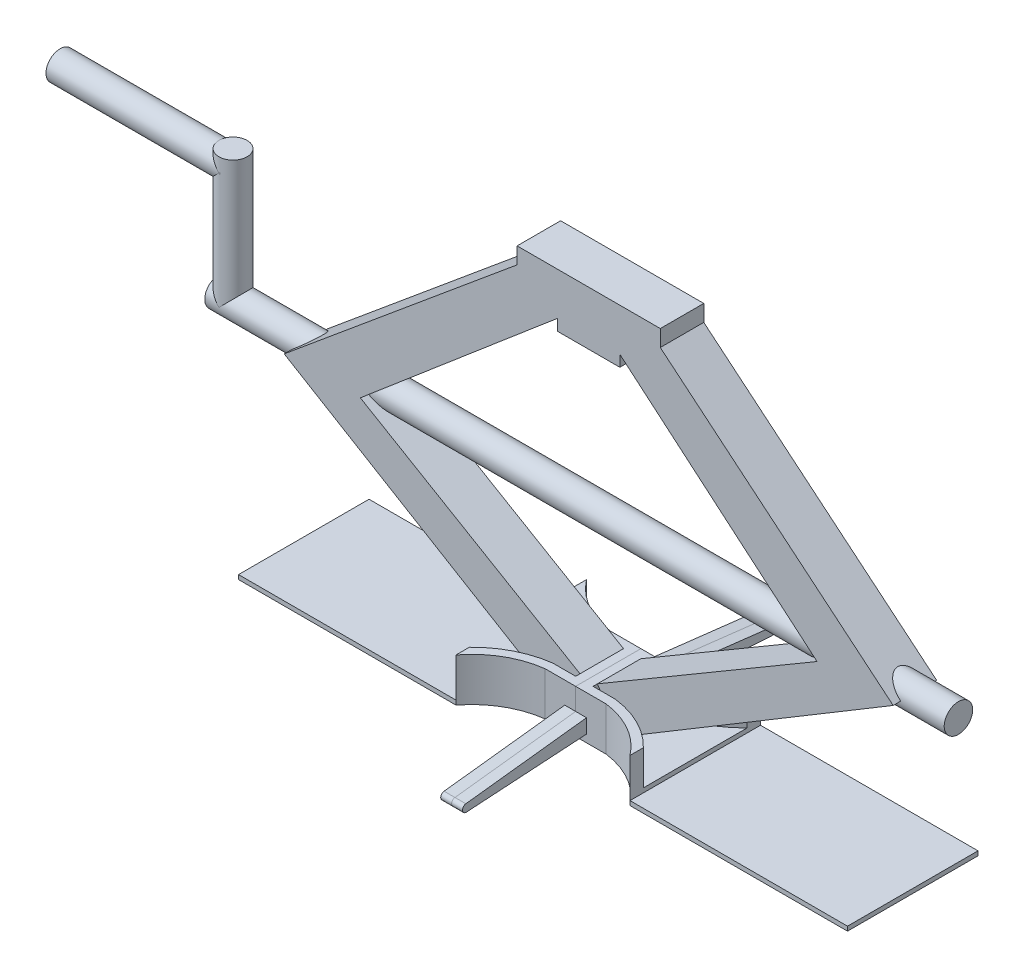
from build123d import *

# Parameters (mm, degrees)
SKETCH2_W                 = 127
SKETCH2_H                 = 76.2
BOSS_EXTRUDE1_DEPTH       = 2.54
BOSS_EXTRUDE2_DEPTH       = 25.4
SHELL1_START              = 5.08
SHELL1_DEPTH              = 20.32
BOSS_EXTRUDE10_DEPTH      = 25.4
BOSS_EXTRUDE11_DEPTH      = 6.35
BOSS_EXTRUDE12_DEPTH      = 203.2
BOSS_EXTRUDE12_DEPTH_BACK = 228.6
SKETCH9_R                 = 8.30646
SKETCH10_R                = 8.255
BOSS_EXTRUDE13_DEPTH      = 76.2
SKETCH11_R                = 8.255
BOSS_EXTRUDE14_DEPTH      = 101.6


# Read off the part's stored shape, not the designer's step: Shell1
with BuildPart() as part:
    # Sketch2 → Boss-Extrude1 (new body)
    with BuildSketch(Plane(origin=(0, 0, 0), x_dir=(1, 0, 0), z_dir=(0, 1, 0))):
        with Locations((-114.3, 0)):
            Rectangle(SKETCH2_W, SKETCH2_H)
    extrude(amount=BOSS_EXTRUDE1_DEPTH)

    # Sketch6 → Boss-Extrude2 (add)
    with BuildSketch(Plane(origin=(0, 0, 0), x_dir=(1, 0, 0), z_dir=(0, 1, 0))):
        with BuildLine():
            Line((-17.860834, -19.05), (0, -19.05))
            Line((0, -19.05), (0, 19.05))
            Line((0, 19.05), (-17.860834, 19.05))
            ThreePointArc((-17.860834, 19.05), (-36.23522, 25.281425), (-50.8, 38.1))
            Line((-50.8, 38.1), (-50.8, -38.1))
            ThreePointArc((-50.8, -38.1), (-36.23522, -25.281425), (-17.860834, -19.05))
        make_face()
    extrude(amount=BOSS_EXTRUDE2_DEPTH)

    # Shell1 outline → Shell1 (cut)
    with BuildSketch(Plane(origin=(0, 0, 0), x_dir=(1, 0, 0), z_dir=(0, 1, 0)).offset(SHELL1_START)):
        with BuildLine():
            Line((-50.8, 30.306695), (-50.8, -30.306695))
            ThreePointArc((-50.8, -30.306695), (-35.897253, -19.331005), (-18.182365, -13.97))
            Line((-18.182365, -13.97), (-5.08, -13.97))
            Line((-5.08, -13.97), (-5.08, 13.97))
            Line((-5.08, 13.97), (-18.182365, 13.97))
            ThreePointArc((-18.182365, 13.97), (-35.897253, 19.331005), (-50.8, 30.306695))
        make_face()
    extrude(amount=SHELL1_DEPTH, mode=Mode.SUBTRACT)

    # Sketch8 → Boss-Extrude11 (add)
    with BuildSketch(Plane(origin=(0, 0, 0), x_dir=(0, 0, -1), z_dir=(1, 0, 0))):
        with BuildLine():
            Line((-19.05, 12.7), (-89.522816, 4.427597))
            ThreePointArc((-89.522816, 4.427597), (-91.484716, 2.139673), (-89.362112, 0))
            Line((-89.362112, 0), (-19.05, 4.427597))
            Line((-19.05, 4.427597), (-19.05, 12.7))
        make_face()
    boss_extrude11 = extrude(amount=-BOSS_EXTRUDE11_DEPTH)

    # Mirror2: Boss-Extrude11 across plane
    add(boss_extrude11.mirror(Plane.XY))


with BuildPart() as body_2:
    # Sketch7 → Boss-Extrude10 (new body)
    with BuildSketch(Plane.XY.offset(-13.97)):
        Polygon((-5.08, 25.4), (-133.344275, 100.810876), (-18.182365, 198.599225), (-18.182365, 192.021824), (0, 192.021824), (0, 223.432601), (-41.80297, 223.432601), (-41.80297, 213.829825), (-177.8, 100.810876), (-18.182365, 5.08), align=None)
    extrude(amount=BOSS_EXTRUDE10_DEPTH)


with BuildPart() as body_3:
    # Mirror3: mirrored copy
    add(body_2.part.mirror(Plane(origin=(0, 0, 0), x_dir=(0, 0, 1), z_dir=(1, 0, 0))))


with BuildPart() as body_4:
    # Mirror3 2: mirrored copy
    add(part.part.mirror(Plane(origin=(0, 0, 0), x_dir=(0, 0, 1), z_dir=(1, 0, 0))))


with BuildPart() as body_2_1:
    add(body_2.part)

    add(body_3.part)  # Boss-Extrude12 merges body 3
    # Sketch9 → Boss-Extrude12 (add, two sides: drawn at the far end of the back side and taken through both)
    with BuildSketch(Plane(origin=(0, 0, 0), x_dir=(0, 0, -1), z_dir=(1, 0, 0)).offset(-BOSS_EXTRUDE12_DEPTH_BACK)):
        with Locations((1.27, 100.810876)):
            Circle(SKETCH9_R)
    extrude(amount=BOSS_EXTRUDE12_DEPTH + BOSS_EXTRUDE12_DEPTH_BACK)

    # Sketch10 → Boss-Extrude13 (add)
    with BuildSketch(Plane(origin=(0, 100.838, 0), x_dir=(1, 0, 0), z_dir=(0, 1, 0))):
        with Locations(Location((-220.345, 1.21854, 0), (0, 0, 180))):
            Circle(SKETCH10_R)
    extrude(amount=BOSS_EXTRUDE13_DEPTH)

    # Sketch11 → Boss-Extrude14 (add)
    with BuildSketch(Plane(origin=(-219.71, 0, 0), x_dir=(0, 0, -1), z_dir=(1, 0, 0))):
        with Locations((1.21854, 168.783)):
            Circle(SKETCH11_R)
    extrude(amount=-BOSS_EXTRUDE14_DEPTH)


solid = Compound([part.part, body_4.part, body_2_1.part])
